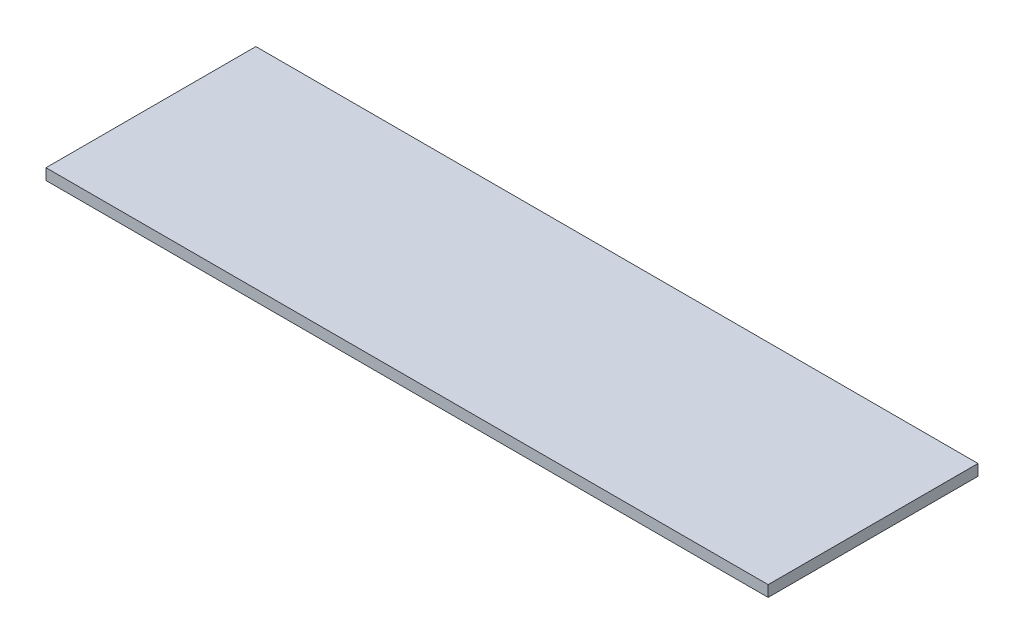
from build123d import *

# Parameters (mm, degrees)
CROQUIS1_W              = 1170
CROQUIS1_H              = 340
SALIENTE_EXTRUIR1_DEPTH = 18


with BuildPart() as part:
    # Croquis1 → Saliente-Extruir1 (new body)
    with BuildSketch(Plane(origin=(0, 0, 0), x_dir=(1, 0, 0), z_dir=(0, 1, 0))):
        Rectangle(CROQUIS1_W, CROQUIS1_H)
    extrude(amount=SALIENTE_EXTRUIR1_DEPTH)


solid = part.part
